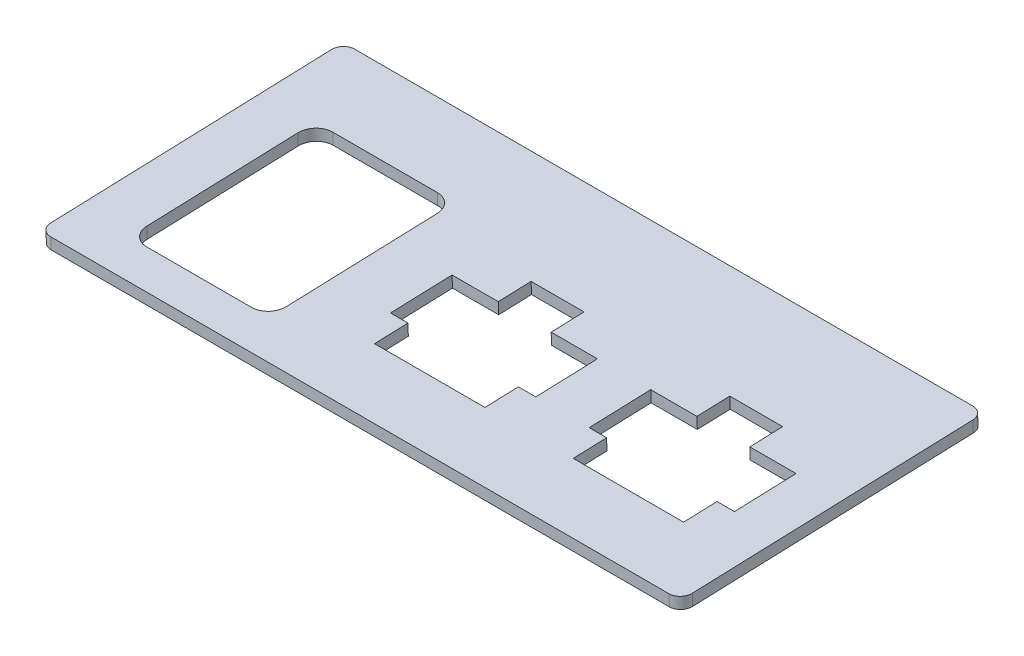
from build123d import *

# Parameters (mm, degrees)
SKETCH1_W           = 110.35
SKETCH1_H           = 52.301351528
BOSS_EXTRUDE1_DEPTH = 2
CUT_EXTRUDE1_REACH  = 75.133
FILLET1_R           = 2


with BuildPart() as part:
    # Sketch1 → Boss-Extrude1 (new body)
    with BuildSketch(Plane(origin=(0, -71.98718802, -2.513847999), x_dir=(1, 0, 0), z_dir=(0, 0.9993908270190958, 0.03489949670250105))):
        with Locations((0, 21.739080484)):
            Rectangle(SKETCH1_W, SKETCH1_H)
    extrude(amount=BOSS_EXTRUDE1_DEPTH)

    # Sketch2 → Cut-Extrude1 (cut, up to next)
    with BuildSketch(Plane(origin=(0, -71.98718802, -2.513847999), x_dir=(1, 0, 0), z_dir=(0, -0.9993908270190958, -0.03489949670250106)), mode=Mode.PRIVATE) as cut_extrude1_sk1:
        Polygon((-4.05, -23.464080484), (-4.05, -29.114080484), (5.05, -29.114080484), (5.05, -23.464080484), (13, -23.464080484), (13, -12.864080484), (10, -12.864080484), (10, -7.114080484), (-9, -7.114080484), (-9, -12.864080484), (-12, -12.864080484), (-12, -23.464080484), align=None)
    cut_extrude1_tool1 = extrude(cut_extrude1_sk1.sketch, amount=-CUT_EXTRUDE1_REACH, mode=Mode.PRIVATE) & part.part
    # Sketch2 → Cut-Extrude1 (cut, up to next)
    with BuildSketch(Plane(origin=(0, -71.98718802, -2.513847999), x_dir=(1, 0, 0), z_dir=(0, -0.9993908270190958, -0.03489949670250106)), mode=Mode.PRIVATE) as cut_extrude1_sk2:
        with BuildLine():
            Line((-43.175, -2.114080484), (-25.175, -2.114080484))
            ThreePointArc((-25.175, -2.114080484), (-23.053679656, -2.99276014), (-22.175, -5.114080484))
            Line((-22.175, -5.114080484), (-22.175, -31.114080484))
            ThreePointArc((-22.175, -31.114080484), (-23.053679656, -33.235400827), (-25.175, -34.114080484))
            Line((-25.175, -34.114080484), (-43.175, -34.114080484))
            ThreePointArc((-43.175, -34.114080484), (-45.296320344, -33.235400827), (-46.175, -31.114080484))
            Line((-46.175, -31.114080484), (-46.175, -5.114080484))
            ThreePointArc((-46.175, -5.114080484), (-45.296320344, -2.99276014), (-43.175, -2.114080484))
        make_face()
    cut_extrude1_tool2 = extrude(cut_extrude1_sk2.sketch, amount=-CUT_EXTRUDE1_REACH, mode=Mode.PRIVATE) & part.part
    # Sketch2 → Cut-Extrude1 (cut, up to next)
    with BuildSketch(Plane(origin=(0, -71.98718802, -2.513847999), x_dir=(1, 0, 0), z_dir=(0, -0.9993908270190958, -0.03489949670250106)), mode=Mode.PRIVATE) as cut_extrude1_sk3:
        Polygon((30.125, -23.464080484), (22.175, -23.464080484), (22.175, -12.864080484), (25.175, -12.864080484), (25.175, -7.114080484), (44.175, -7.114080484), (44.175, -12.864080484), (47.175, -12.864080484), (47.175, -23.464080484), (39.225, -23.464080484), (39.225, -29.114080484), (30.125, -29.114080484), align=None)
    cut_extrude1_tool3 = extrude(cut_extrude1_sk3.sketch, amount=-CUT_EXTRUDE1_REACH, mode=Mode.PRIVATE) & part.part
    add(cut_extrude1_tool1.solids().sort_by_distance((0.5, -71.392246, -19.550769))[0], mode=Mode.SUBTRACT)
    add(cut_extrude1_tool2.solids().sort_by_distance((-34.175, -71.355016, -20.616894))[0], mode=Mode.SUBTRACT)
    add(cut_extrude1_tool3.solids().sort_by_distance((34.675, -71.392246, -19.550769))[0], mode=Mode.SUBTRACT)

    # Fillet1
    fillet1_edges = [part.edges().sort_by_distance(p)[0] for p in [
        (-55.175, -71.141759648, 1.929959353),
        (55.175, -71.141759648, 1.929959353),
        (55.175, -69.316468803, -50.339531605),
        (-55.175, -69.316468803, -50.339531605),
    ]]
    fillet(fillet1_edges, radius=FILLET1_R)


solid = part.part
